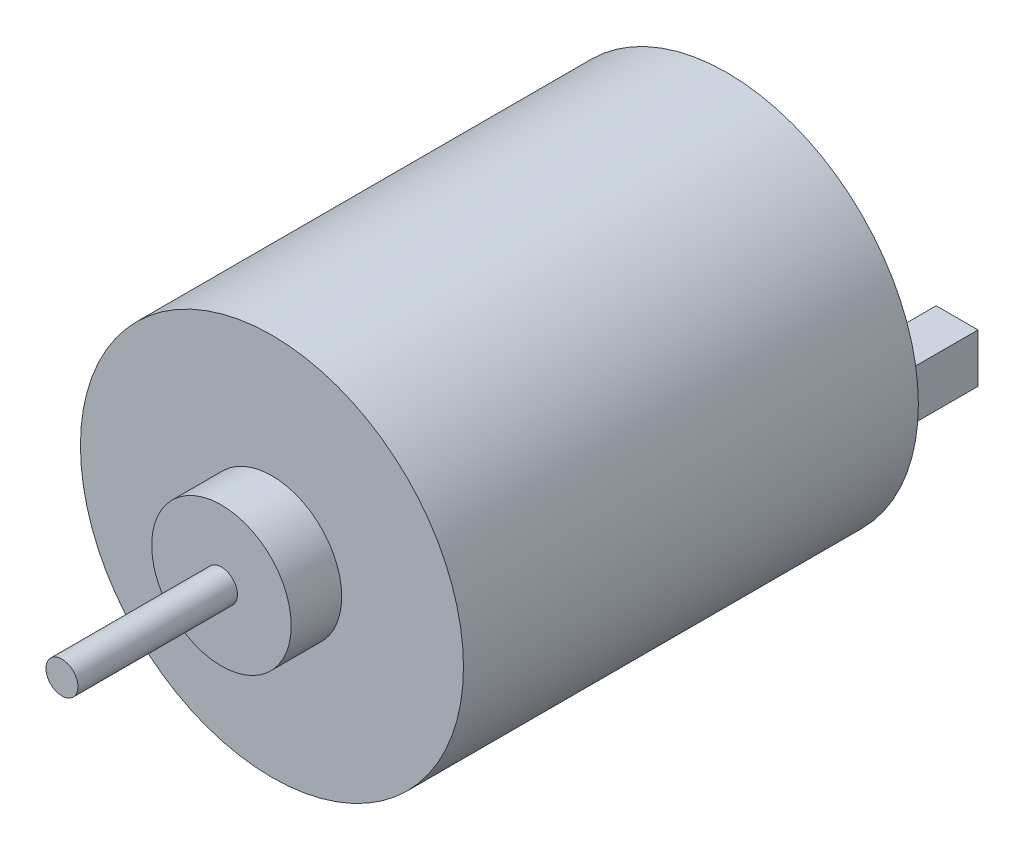
from build123d import *

# Parameters (mm, degrees)
SKETCH1_R           = 13.725
BOSS_EXTRUDE1_DEPTH = 32.6
SKETCH2_R           = 5
BOSS_EXTRUDE2_DEPTH = 3.62
SKETCH3_R           = 1.145
BOSS_EXTRUDE3_DEPTH = 11.43
BOSS_EXTRUDE4_START = 2.15
SKETCH4_R           = 5
BOSS_EXTRUDE4_DEPTH = 2.15
SKETCH5_R           = 1.15
BOSS_EXTRUDE5_DEPTH = 1
SKETCH6_W           = 3
SKETCH6_H           = 3.5
BOSS_EXTRUDE6_DEPTH = 5


with BuildPart() as part:
    # Sketch1 → Boss-Extrude1 (new body)
    with BuildSketch(Plane.XY):
        Circle(SKETCH1_R)
    extrude(amount=BOSS_EXTRUDE1_DEPTH)

    # Sketch2 → Boss-Extrude2 (add)
    with BuildSketch(Plane.XY.offset(32.6)):
        Circle(SKETCH2_R)
    extrude(amount=BOSS_EXTRUDE2_DEPTH)

    # Sketch3 → Boss-Extrude3 (add)
    with BuildSketch(Plane.XY.offset(36.22)):
        Circle(SKETCH3_R)
    extrude(amount=BOSS_EXTRUDE3_DEPTH)

    # Sketch4 → Boss-Extrude4 (add)
    with BuildSketch(Plane(origin=(0, 0, 0), x_dir=(-1, 0, 0), z_dir=(0, 0, -1)).offset(BOSS_EXTRUDE4_START)):
        Circle(SKETCH4_R)
    extrude(amount=-BOSS_EXTRUDE4_DEPTH)

    # Sketch5 → Boss-Extrude5 (add)
    with BuildSketch(Plane(origin=(0, 0, -2.15), x_dir=(-1, 0, 0), z_dir=(0, 0, -1))):
        Circle(SKETCH5_R)
    extrude(amount=BOSS_EXTRUDE5_DEPTH)

    # Sketch6 → Boss-Extrude6 (add)
    with BuildSketch(Plane(origin=(0, 0, 0), x_dir=(-1, 0, 0), z_dir=(0, 0, -1))):
        with Locations((-11.5, 0)):
            Rectangle(SKETCH6_W, SKETCH6_H)
        with Locations((11.5, 0)):
            Rectangle(SKETCH6_W, SKETCH6_H)
    extrude(amount=BOSS_EXTRUDE6_DEPTH)


solid = part.part
